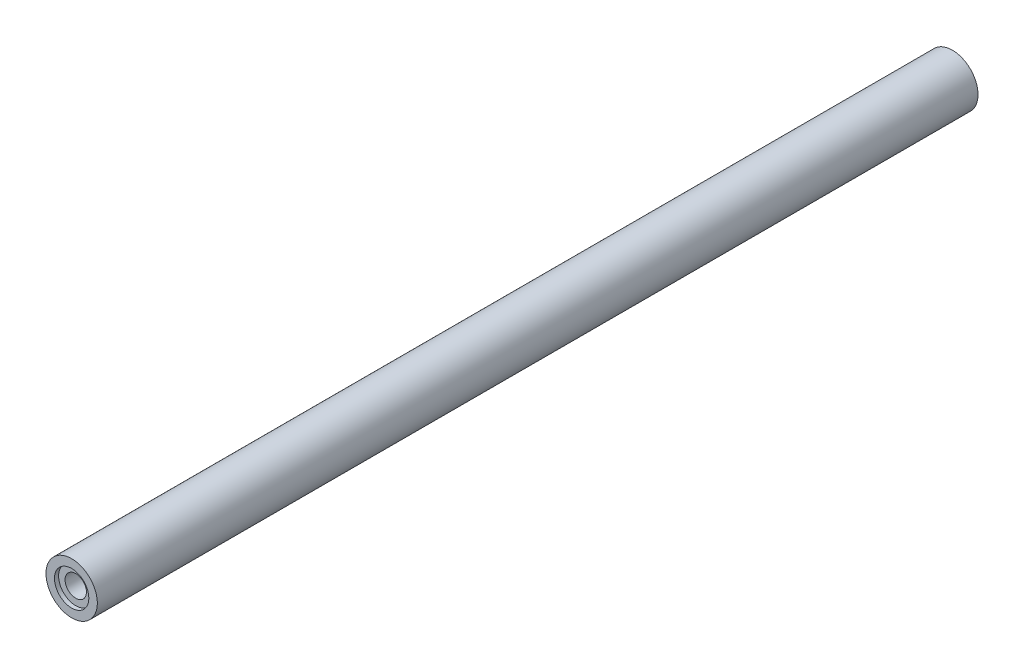
from build123d import *

# Parameters (mm, degrees)
SKETCH1_R                   = 9.525
BOSS_EXTRUDE1_DEPTH         = 327.025
SKETCH2_R                   = 6.3754
CUT_EXTRUDE1_DEPTH          = 1.524
F_3_8_16_TAPPED_HOLE1_D     = 7.9375
F_3_8_16_TAPPED_HOLE1_DEPTH = 25.4
F_3_8_16_TAPPED_HOLE1_TIP   = 2.384665582
CUT_EXTRUDE2_START          = -1.524
SKETCH5_R                   = 6.3754
CUT_EXTRUDE2_DEPTH          = 1.524
F_3_8_16_TAPPED_HOLE2_D     = 7.9375
F_3_8_16_TAPPED_HOLE2_DEPTH = 25.4
F_3_8_16_TAPPED_HOLE2_TIP   = 2.384665582


with BuildPart() as part:
    # Sketch1 → Boss-Extrude1 (new body)
    with BuildSketch(Plane.XY):
        Circle(SKETCH1_R)
    extrude(amount=BOSS_EXTRUDE1_DEPTH)

    # Sketch2 → Cut-Extrude1 (cut)
    with BuildSketch(Plane.XY.offset(327.025)):
        Circle(SKETCH2_R)
    extrude(amount=-CUT_EXTRUDE1_DEPTH, mode=Mode.SUBTRACT)

    # 3/8-16 Tapped Hole1
    with Locations(Plane.XY.offset(325.501)):
        with Locations((0, 0)):
            Hole(F_3_8_16_TAPPED_HOLE1_D / 2, depth=F_3_8_16_TAPPED_HOLE1_DEPTH)
            with Locations((0, 0, -(F_3_8_16_TAPPED_HOLE1_DEPTH + F_3_8_16_TAPPED_HOLE1_TIP / 2))):  # 118° drill point
                Cone(0, F_3_8_16_TAPPED_HOLE1_D / 2, F_3_8_16_TAPPED_HOLE1_TIP, mode=Mode.SUBTRACT)

    # Sketch5 → Cut-Extrude2 (cut)
    with BuildSketch(Plane(origin=(0, 0, 0), x_dir=(-1, 0, 0), z_dir=(0, 0, -1)).offset(CUT_EXTRUDE2_START)):
        Circle(SKETCH5_R)
    extrude(amount=CUT_EXTRUDE2_DEPTH, mode=Mode.SUBTRACT)

    # 3/8-16 Tapped Hole2
    with Locations(Plane(origin=(0, 0, 1.524), x_dir=(-1, 0, 0), z_dir=(0, 0, -1))):
        with Locations((0, 0)):
            Hole(F_3_8_16_TAPPED_HOLE2_D / 2, depth=F_3_8_16_TAPPED_HOLE2_DEPTH)
            with Locations((0, 0, -(F_3_8_16_TAPPED_HOLE2_DEPTH + F_3_8_16_TAPPED_HOLE2_TIP / 2))):  # 118° drill point
                Cone(0, F_3_8_16_TAPPED_HOLE2_D / 2, F_3_8_16_TAPPED_HOLE2_TIP, mode=Mode.SUBTRACT)


solid = part.part
